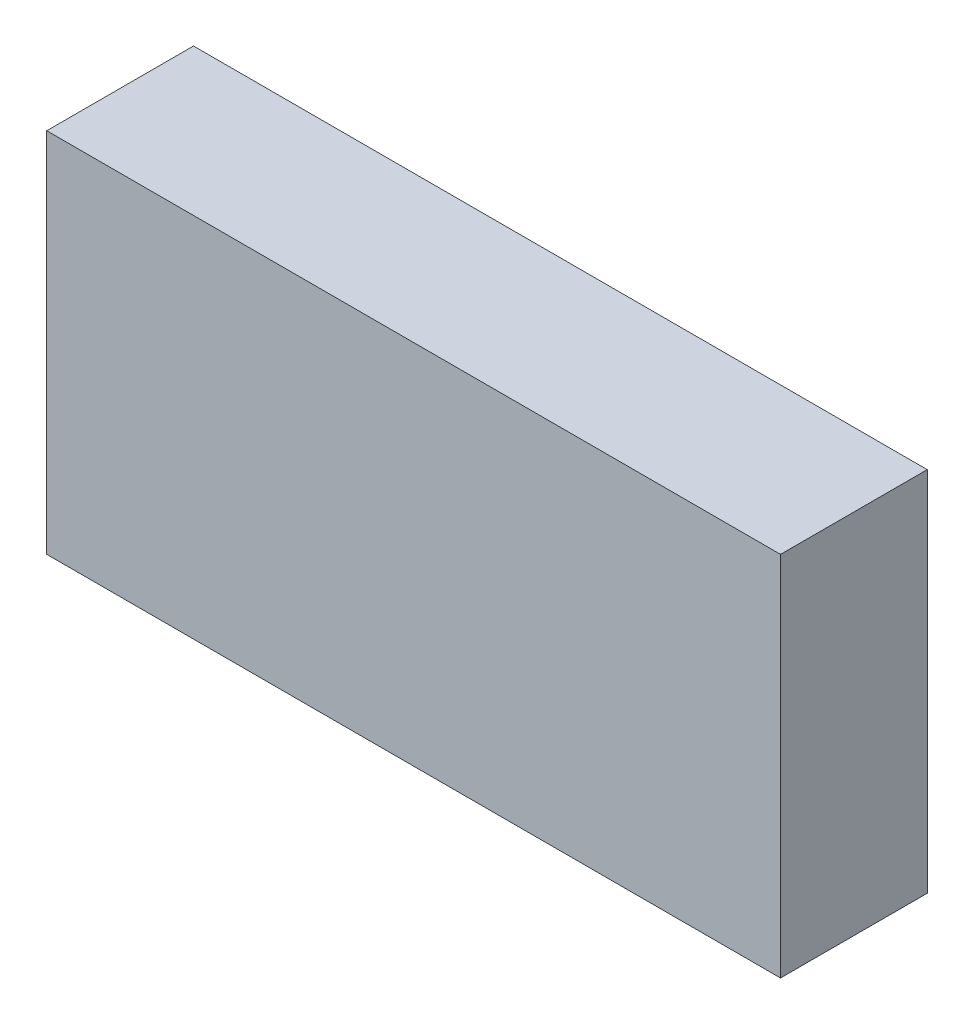
from build123d import *

# Parameters (mm, degrees)
SKETCH1_W           = 200
SKETCH1_H           = 40
BOSS_EXTRUDE1_DEPTH = 100


with BuildPart() as part:
    # Sketch1 → Boss-Extrude1 (new body)
    with BuildSketch(Plane(origin=(0, 0, 0), x_dir=(1, 0, 0), z_dir=(0, 1, 0))):
        with Locations((100, 20)):
            Rectangle(SKETCH1_W, SKETCH1_H)
    extrude(amount=BOSS_EXTRUDE1_DEPTH)


solid = part.part
